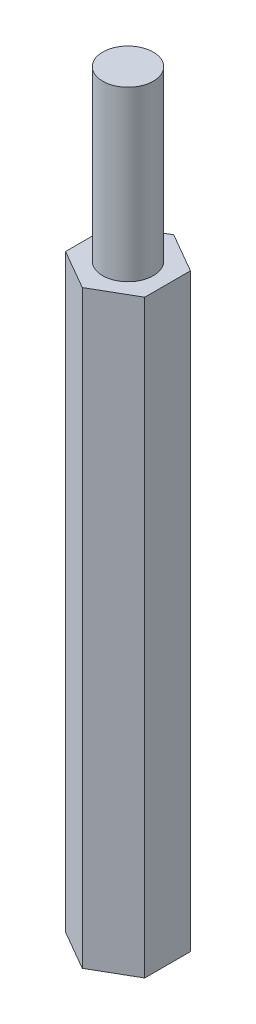
from build123d import *

# Parameters (mm, degrees)
BOSS_EXTRUDE1_DEPTH = 35
SKETCH2_R           = 1.5
BOSS_EXTRUDE2_DEPTH = 10
SKETCH5_R           = 1.5
CUT_EXTRUDE1_DEPTH  = 10


with BuildPart() as part:
    # Sketch1 → Boss-Extrude1 (new body)
    with BuildSketch(Plane(origin=(0, 0, 0), x_dir=(1, 0, 0), z_dir=(0, 1, 0))):
        Polygon((0, 2.713546265), (-2.35, 1.356773133), (-2.35, -1.356773133), (0, -2.713546265), (2.35, -1.356773133), (2.35, 1.356773133), align=None)
    extrude(amount=BOSS_EXTRUDE1_DEPTH)

    # Sketch2 → Boss-Extrude2 (add)
    with BuildSketch(Plane(origin=(0, 35, 0), x_dir=(1, 0, 0), z_dir=(0, 1, 0))):
        Circle(SKETCH2_R)
    extrude(amount=BOSS_EXTRUDE2_DEPTH)

    # Sketch5 → Cut-Extrude1 (cut)
    with BuildSketch(Plane.XZ):
        Circle(SKETCH5_R)
    extrude(amount=-CUT_EXTRUDE1_DEPTH, mode=Mode.SUBTRACT)


solid = part.part
